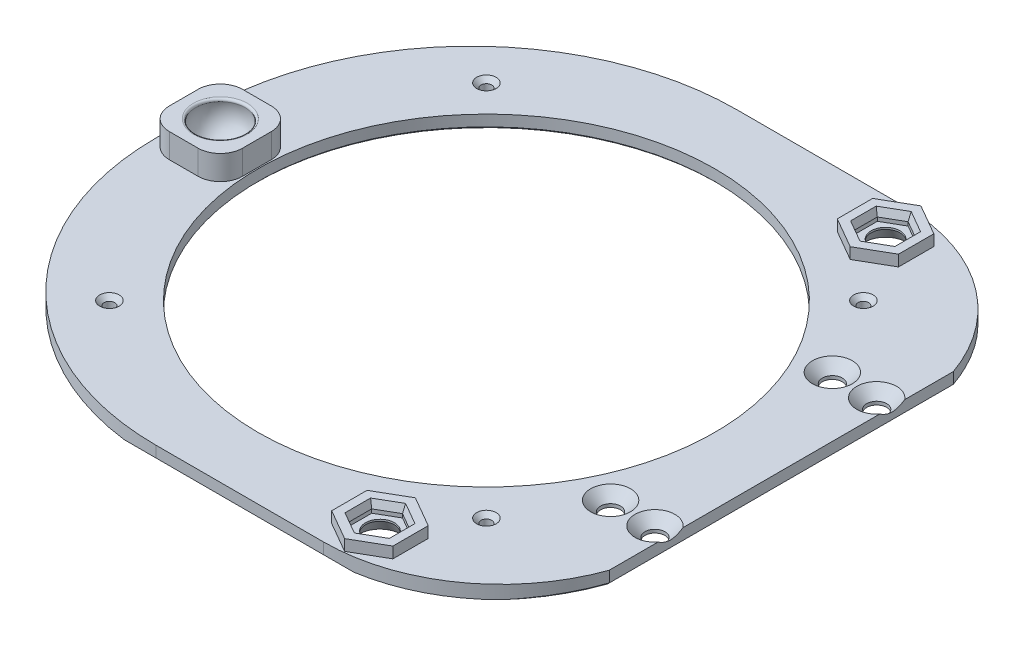
from build123d import *
from OCP.BRepFilletAPI import BRepFilletAPI_MakeChamfer

# Parameters (mm, degrees)
SKETCH_1_W           = 276
SKETCH_1_H           = 276
EXTRUDE_1_DEPTH      = 6
SKETCH_4_R           = 6.5
SKETCH_4_R_2         = 2
CUT_EXTRUDE_1_DEPTH  = 10
SKETCH_5_R           = 2.4
CUT_EXTRUDE_2_DEPTH  = 196.253681143
FILLET_1_R           = 90
EXTRUDE_1_2_DEPTH    = 5
CHAMFER_2_SIZE       = 1.2
CHAMFER_2_SIZE2      = 3.296972903
SKETCH_9_W           = 33
SKETCH_9_H           = 33
EXTRUDE_2_DEPTH      = 11
FILLET_2_R           = 1
FILLET_3_R           = 10
CHAMFER_5_SIZE       = 3
CHAMFER_5_SIZE2      = 5.196152423
SKETCH_6_R           = 103
CUT_EXTRUDE_3_DEPTH  = 10
CHAMFER_6_SIZE       = 2
SKETCH_13_R          = 4.5
CUT_EXTRUDE_6_DEPTH  = 196.47122551
SKETCH_18_W          = 352.666964083
SKETCH_18_H          = 12.846548741
SKETCH_18_W_2        = 47.896370642
SKETCH_18_H_2        = 198.133814491
CUT_EXTRUDE_10_DEPTH = 196.900484949
CHAMFER_7_SIZE       = 4.5
CHAMFER_8_SIZE       = 1
FILLET_4_R           = 120
FILLET_5_R           = 80


with BuildPart() as part:
    # Эскиз1 → Extrude 1 (new body)
    with BuildSketch(Plane(origin=(0, 0, 0), x_dir=(1, 0, 0), z_dir=(0, 1, 0))):
        Rectangle(SKETCH_1_W, SKETCH_1_H)
    extrude(amount=EXTRUDE_1_DEPTH)

    # Эскиз4 → Cut-Extrude 1 (cut)
    with BuildSketch(Plane(origin=(0, 6, 0), x_dir=(1, 0, 0), z_dir=(0, 1, 0))):
        with Locations(Location((66, 114, 0), (0, 0, 270))):
            Circle(SKETCH_4_R)
        with Locations(Location((-120, 0, 0), (0, 0, 270))):
            Circle(SKETCH_4_R_2)
        with Locations(Location((66, -114, 0), (0, 0, 90))):
            Circle(SKETCH_4_R)
    extrude(amount=-CUT_EXTRUDE_1_DEPTH, mode=Mode.SUBTRACT)

    # Эскиз5 → Вырез-Вытянуть2 (cut, through all)
    with BuildSketch(Plane(origin=(0, 6, 0), x_dir=(1, 0, 0), z_dir=(0, 1, 0))):
        with Locations(Location((-85, 85, 0), (0, 0, 270))):
            Circle(SKETCH_5_R)
        with Locations(Location((85, 85, 0), (0, 0, 270))):
            Circle(SKETCH_5_R)
        with Locations(Location((85, -85, 0), (0, 0, 270))):
            Circle(SKETCH_5_R)
        with Locations(Location((-85, -85, 0), (0, 0, 270))):
            Circle(SKETCH_5_R)
        with Locations(Location((-90, 0, 0), (0, 0, 270))):
            Circle(SKETCH_5_R)
        with Locations(Location((0, 90, 0), (0, 0, 270))):
            Circle(SKETCH_5_R)
        with Locations(Location((0, -90, 0), (0, 0, 90))):
            Circle(SKETCH_5_R)
        with Locations(Location((90, 0, 0), (0, 0, 90))):
            Circle(SKETCH_5_R)
    extrude(amount=-CUT_EXTRUDE_2_DEPTH, mode=Mode.SUBTRACT)

    # Скругление1
    fillet_1_edges = [part.edges().sort_by_distance(p)[0] for p in [
        (138, 3, 138),
        (-138, 3, 138),
        (-138, 3, -138),
        (138, 3, -138),
    ]]
    fillet(fillet_1_edges, radius=FILLET_1_R)

    # Extrude 1 2: read off the stored shape, not the designer's step
    # Extrude 1 2 outline → Extrude 1 2 (add)
    # profile 1 of 2: a face of its own
    with BuildSketch(Plane(origin=(0, 6, 0), x_dir=(1, 0, 0), z_dir=(0, 1, 0))):
        Polygon((79.8, -106.032566285), (66, -98.06513257), (52.2, -106.032566285), (52.2, -121.967433715), (66, -129.93486743), (79.8, -121.967433715), align=None)
        Polygon((57.2, -108.919317631), (66, -103.838635262), (74.8, -108.919317631), (74.8, -119.080682369), (66, -124.161364738), (57.2, -119.080682369), align=None, mode=Mode.SUBTRACT)
    # profile 2 of 2: a face of its own
    with BuildSketch(Plane(origin=(0, 6, 0), x_dir=(1, 0, 0), z_dir=(0, 1, 0))):
        Polygon((52.2, 121.967433715), (52.2, 106.032566285), (66, 98.06513257), (79.8, 106.032566285), (79.8, 121.967433715), (66, 129.93486743), align=None)
        Polygon((66, 103.838635262), (57.2, 108.919317631), (57.2, 119.080682369), (66, 124.161364738), (74.8, 119.080682369), (74.8, 108.919317631), align=None, mode=Mode.SUBTRACT)
    extrude(amount=EXTRUDE_1_2_DEPTH)

    # Фаска2: one chamfer whose edges measure the first distance from different faces: ONE call of the kernel's chamfer builder (chamfer() names one face for all edges)
    chamfer_2_edges_1 = [part.edges().sort_by_distance(p)[0] for p in [
        (70.4, 11, 106.378976446),
        (61.6, 11, 106.378976447),
        (57.2, 11, 114),
        (61.6, 11, 121.621023554),
        (70.4, 11, 121.621023553),
        (74.8, 11, 114),
    ]]
    chamfer_2_side_1 = [part.faces().sort_by_distance(p)[0] for p in [
        (72.689201518, 11, 102.413963108),
    ]]
    chamfer_2_edges_2 = [part.edges().sort_by_distance(p)[0] for p in [
        (74.8, 11, -114),
        (70.4, 11, -121.621023554),
        (61.6, 11, -121.621023553),
        (57.2, 11, -114),
        (61.6, 11, -106.378976446),
        (70.4, 11, -106.378976447),
    ]]
    chamfer_2_side_2 = [part.faces().sort_by_distance(p)[0] for p in [
        (52.621596964, 11, -114),
    ]]
    chamfer_2 = BRepFilletAPI_MakeChamfer(part.part.solid().wrapped)
    for e in chamfer_2_edges_1:
        chamfer_2.Add(CHAMFER_2_SIZE, CHAMFER_2_SIZE2, e.wrapped, chamfer_2_side_1[0].wrapped)  # the first distance lies on this face
    for e in chamfer_2_edges_2:
        chamfer_2.Add(CHAMFER_2_SIZE, CHAMFER_2_SIZE2, e.wrapped, chamfer_2_side_2[0].wrapped)  # the first distance lies on this face
    add(Compound.cast(chamfer_2.Shape()), mode=Mode.REPLACE)

    # Эскиз9 → Бобышка-Вытянуть2 (add)
    with BuildSketch(Plane(origin=(0, 6, 0), x_dir=(1, 0, 0), z_dir=(0, 1, 0))):
        with Locations((-120, 0)):
            Rectangle(SKETCH_9_W, SKETCH_9_H)
    extrude(amount=EXTRUDE_2_DEPTH)

    # Эскиз10 → Вырез-Повернуть1 (revolve, cut)
    with BuildSketch(Plane(origin=(0, 13, 0), x_dir=(1, 0, 0), z_dir=(0, 1, 0))):
        with BuildLine():
            Line((-131.5, 0), (-108.5, 0))
            ThreePointArc((-108.5, 0), (-120, 11.5), (-131.5, 0))
        make_face()
    revolve(axis=Axis((-131.5, 13, 0), (1, 0, 0)), mode=Mode.SUBTRACT)

    # Скругление2
    fillet_2_edges = [part.edges().sort_by_distance(p)[0] for p in [
        (-119.999999999, 1.675248347, -1.999999986),
        (-120, 17, -10.781929326),
    ]]
    fillet(fillet_2_edges, radius=FILLET_2_R)

    # Скругление3
    fillet_3_edges = [part.edges().sort_by_distance(p)[0] for p in [
        (-103.5, 11.5, 16.5),
        (-103.5, 11.5, -16.5),
        (-136.5, 11.5, -16.5),
        (-136.5, 11.5, 16.5),
    ]]
    fillet(fillet_3_edges, radius=FILLET_3_R)

    # Фаска5
    chamfer_5_edges = [part.edges().sort_by_distance(p)[0] for p in [
        (66, 0, 120.5),
        (66, 0, -120.5),
    ]]
    chamfer_5_side = [part.faces().sort_by_distance(p)[0] for p in [
        (-0.232742345, 0, 0),
    ]]
    chamfer(chamfer_5_edges, length=CHAMFER_5_SIZE, length2=CHAMFER_5_SIZE2, reference=chamfer_5_side[0])

    # Эскиз6 → Вырез-Вытянуть3 (cut)
    with BuildSketch(Plane(origin=(0, 6, 0), x_dir=(1, 0, 0), z_dir=(0, 1, 0))):
        with Locations(Location((0, 0, 0), (0, 0, 270))):
            Circle(SKETCH_6_R)
    extrude(amount=-CUT_EXTRUDE_3_DEPTH, mode=Mode.SUBTRACT)

    # Фаска6
    chamfer_6_edges = [part.edges().sort_by_distance(p)[0] for p in [
        (85, 6, -87.4),
        (85, 6, 82.6),
        (-85, 6, 82.6),
        (-85, 6, -87.4),
    ]]
    chamfer(chamfer_6_edges, length=CHAMFER_6_SIZE)

    # Эскиз13 → Вырез-Вытянуть6 (cut, through all)
    with BuildSketch(Plane(origin=(0, 6, 0), x_dir=(1, 0, 0), z_dir=(0, 1, 0))):
        with Locations(Location((126, 50, 0), (0, 0, 270))):
            Circle(SKETCH_13_R)
        with Locations(Location((126, -50, 0), (0, 0, 90))):
            Circle(SKETCH_13_R)
        with Locations(Location((106, -50, 0), (0, 0, 270))):
            Circle(SKETCH_13_R)
        with Locations(Location((106, 50, 0), (0, 0, 90))):
            Circle(SKETCH_13_R)
    extrude(amount=-CUT_EXTRUDE_6_DEPTH, mode=Mode.SUBTRACT)

    # Эскиз18 → Вырез-Вытянуть10 (cut, through all)
    with BuildSketch(Plane(origin=(0, 17, 0), x_dir=(1, 0, 0), z_dir=(0, 1, 0))):
        with Locations((-14.279105497, 137.42327437)):
            Rectangle(SKETCH_18_W, SKETCH_18_H)
        with Locations((-14.279105497, -137.42327437)):
            Rectangle(SKETCH_18_W, SKETCH_18_H)
        with Locations((156.948185321, -9.822497885)):
            Rectangle(SKETCH_18_W_2, SKETCH_18_H_2)
    extrude(amount=-CUT_EXTRUDE_10_DEPTH, mode=Mode.SUBTRACT)

    # Фаска7
    # the kernel refuses this chamfer: 4.5 mm, written as the material it takes off along each edge
    with BuildSketch(Plane(origin=(106, 6, -50), x_dir=(0, 0, -1), z_dir=(1, 0, 0))) as chamfer_7_piece_1:
        Polygon((4.5 + CHAMFER_7_SIZE, 0), (4.5, -CHAMFER_7_SIZE), (4.5, 0), align=None)
    revolve(axis=Axis((106, 6, -50), (0, 1, 0)), mode=Mode.SUBTRACT)
    with BuildSketch(Plane(origin=(106, 6, 50), x_dir=(0, 0, 1), z_dir=(-1, 0, 0))) as chamfer_7_piece_2:
        Polygon((4.5 + CHAMFER_7_SIZE, 0), (4.5, -CHAMFER_7_SIZE), (4.5, 0), align=None)
    revolve(axis=Axis((106, 6, 50), (0, 1, 0)), mode=Mode.SUBTRACT)
    with BuildSketch(Plane(origin=(126, 6, 50), x_dir=(0, 0, -1), z_dir=(1, 0, 0))) as chamfer_7_piece_3:
        Polygon((4.5 + CHAMFER_7_SIZE, 0), (4.5, -CHAMFER_7_SIZE), (4.5, 0), align=None)
    revolve(axis=Axis((126, 6, 50), (0, 1, 0)), mode=Mode.SUBTRACT)
    with BuildSketch(Plane(origin=(126, 6, -50), x_dir=(0, 0, 1), z_dir=(-1, 0, 0))) as chamfer_7_piece_4:
        Polygon((4.5 + CHAMFER_7_SIZE, 0), (4.5, -CHAMFER_7_SIZE), (4.5, 0), align=None)
    revolve(axis=Axis((126, 6, -50), (0, 1, 0)), mode=Mode.SUBTRACT)

    # Фаска8
    chamfer_8_edges = [part.edges().sort_by_distance(p)[0] for p in [
        (0, 0, -103),
        (113.584975562, 0, 109.632872564),
        (113.584975562, 0, -109.632872564),
        (-122.939803427, 0, 97.840002631),
        (0, 0, -131),
        (0, 0, 131),
        (133, 0, 0),
        (-138, 0, 0),
        (-122.939803427, 0, -97.840002631),
    ]]
    chamfer(chamfer_8_edges, length=CHAMFER_8_SIZE)

    # Скругление4
    # the kernel refuses this fillet: 120 mm, written as the material it takes off along each edge
    with BuildSketch(Plane(origin=(-82.799425283, -329.218710186, 131), x_dir=(1, 0, 0), z_dir=(0, 1, 0))) as fillet_4_piece_1:
        with BuildLine():
            CenterArc((64.799425283, 120), FILLET_4_R, 180, 90)
            Line((-55.200574717, 120), (-67.200574717, 120))
            ThreePointArc((-67.200574717, 120), (-67.200574717, 83), (-4.639923371, -11.066666667))
            Line((-4.639923371, -11.066666667), (0, -12))
            Line((0, -12), (64.799425283, -12))
            Line((64.799425283, -12), (64.799425283, 0))
        make_face()
    extrude(amount=665.437420372, mode=Mode.SUBTRACT)
    with BuildSketch(Plane(origin=(-82.799425283, -329.218710186, -131), x_dir=(1, 0, 0), z_dir=(0, 1, 0))) as fillet_4_piece_2:
        with BuildLine():
            CenterArc((64.799425283, -120), FILLET_4_R, 90, 90)
            Line((-55.200574717, -120), (-67.200574717, -120))
            ThreePointArc((-67.200574717, -120), (-67.200574717, -83), (-4.639923371, 11.066666667))
            Line((-4.639923371, 11.066666667), (0, 12))
            Line((0, 12), (64.799425283, 12))
            Line((64.799425283, 12), (64.799425283, 0))
        make_face()
    extrude(amount=665.437420372, mode=Mode.SUBTRACT)

    # Скругление5
    # the kernel refuses this fillet: 80 mm, written as the material it takes off along each edge
    with BuildSketch(Plane(origin=(82.799425283, -182.264690441, -131), x_dir=(-1, 0, 0), z_dir=(0, 1, 0))) as fillet_5_piece_1:
        with BuildLine():
            CenterArc((25.254593386, 80), FILLET_5_R, 199.405701267, 70.594298733)
            Line((-50.200574717, 53.419601085), (-51.709678079, 52.887993106))
            ThreePointArc((-51.709678079, 52.887993106), (-31.951505401, 20.271431924), (-0.618656449, -1.475555556))
            Line((-0.618656449, -1.475555556), (0, -1.6))
            Line((0, -1.6), (25.254593386, -1.6))
            Line((25.254593386, -1.6), (25.254593386, 0))
        make_face()
    extrude(amount=371.529380882, mode=Mode.SUBTRACT)
    with BuildSketch(Plane(origin=(82.799425283, -182.264690441, 131), x_dir=(-1, 0, 0), z_dir=(0, 1, 0))) as fillet_5_piece_2:
        with BuildLine():
            CenterArc((25.254593386, -80), FILLET_5_R, 90, 70.594298733)
            Line((-50.200574717, -53.419601085), (-51.709678079, -52.887993106))
            ThreePointArc((-51.709678079, -52.887993106), (-31.951505401, -20.271431924), (-0.618656449, 1.475555556))
            Line((-0.618656449, 1.475555556), (0, 1.6))
            Line((0, 1.6), (25.254593386, 1.6))
            Line((25.254593386, 1.6), (25.254593386, 0))
        make_face()
    extrude(amount=371.529380882, mode=Mode.SUBTRACT)


solid = part.part
